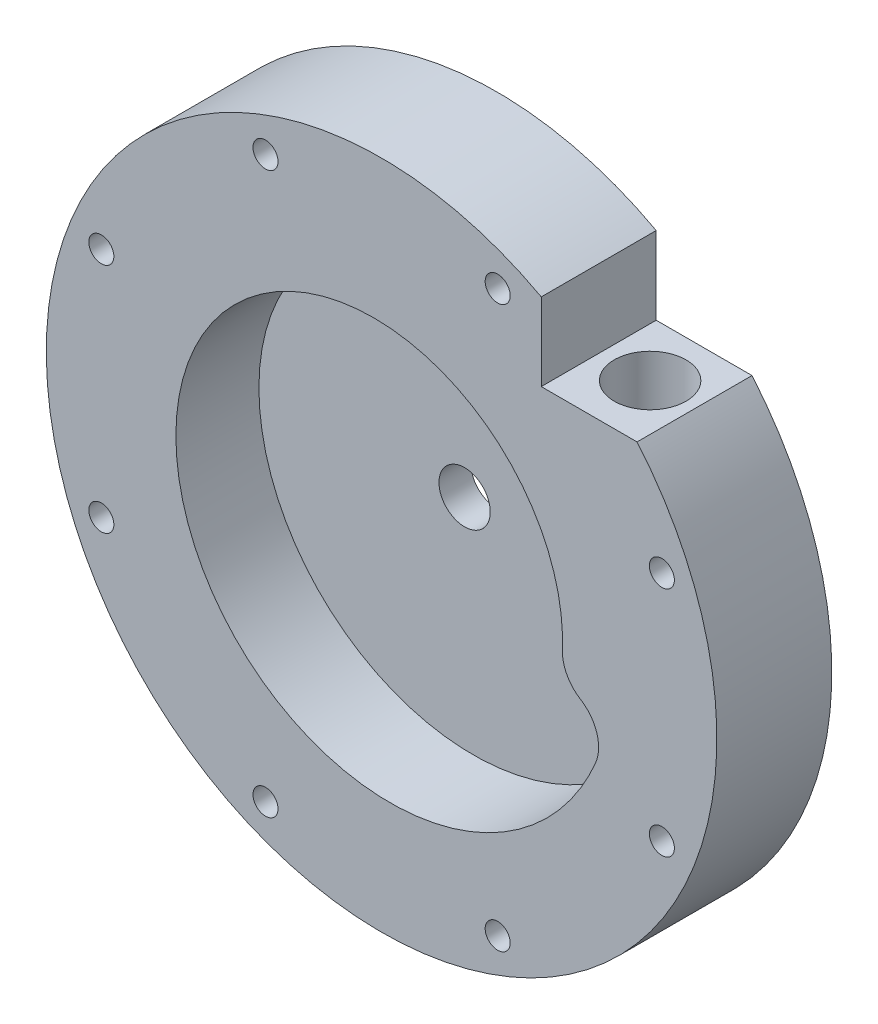
from build123d import *

# Parameters (mm, degrees)
VOLUTE_CUT_DEPTH      = 96.72717143
SKETCH28_W            = 19.053968595
SKETCH28_H            = 15.450138368
OUTLET_HOLE_CUT_DEPTH = 98.024176764
OUTLET_HOLE_D         = 9.8044
OUTLET_HOLE_DEPTH     = 55.88
OUTLET_HOLE_TIP       = 2.945538927
OUTLET_NPT_D          = 14.2748
OUTLET_NPT_DEPTH      = 12.7
OUTLET_NPT_TIP        = 4.288582582
FASTENER_HOLES_D      = 4.9784
CIRPATTERN1_COUNT     = 8


with BuildPart() as part:
    # Sketch22 → Main Body (revolve)
    with BuildSketch(Plane(origin=(0, 0, 0), x_dir=(1, 0, 0), z_dir=(0, 1, 0))):
        Polygon((-25.4, 0), (-5.1, 0), (-5.1, 6.35), (-11.1125, 6.35), (-11.1125, 4.7625), (-17.4625, 4.7625), (-17.4625, 6.35), (-66.675, 6.35), (-66.675, -16.51), (-25.4, -16.51), align=None)
    revolve(axis=Axis((0, 0, 0), (0, 0, -1)))

    # Sketch23 → Volute Cut (cut, through all)
    with BuildSketch(Plane.XY):
        with BuildLine():
            ThreePointArc((42.554027377, -16.231646763), (42.805320101, -10.94498561), (39.552581276, -6.769865934))
            ThreePointArc((39.552581276, -6.769865934), (36.836858206, -3.87137787), (35.948703812, 0))
            add(Edge.make_bspline(
                [(35.948703812, 0), (35.9515816, 0.07538119), (35.957337916, 0.226162951), (35.964207937, 0.452426553), (35.969771157, 0.678783022), (35.978029534, 1.131847853), (35.980843708, 2.190601907), (35.920311441, 3.779931016), (35.747323363, 5.668216834), (35.489928088, 7.474298946), (35.141459932, 9.268877369), (34.702390603, 11.047358984), (34.17343386, 12.80516853), (33.555538624, 14.537761538), (32.849887572, 16.240636382), (32.057893687, 17.909346365), (31.181197352, 19.53951152), (30.221662701, 21.126830276), (29.181373626, 22.667090912), (28.062629225, 24.156182809), (26.867938753, 25.590107465), (25.60001603, 26.964989265), (24.261773335, 28.277085961), (22.856314773, 29.522798851), (21.386929147, 30.698682629), (19.85708232, 31.801454876), (18.270409111, 32.828005175), (16.630704717, 33.775403815), (14.941915703, 34.640910073), (13.208130556, 35.421980041), (11.43356985, 36.116273987), (9.622576022, 36.721663214), (7.779602801, 37.236236415), (5.909204301, 37.658305492), (4.016023818, 37.986410831), (2.104782347, 38.219326014), (0.180266852, 38.356061949), (-1.75268168, 38.395870413), (-3.689180377, 38.338246992), (-5.624316777, 38.182933409), (-7.553161251, 37.929919231), (-9.470779522, 37.579442948), (-11.37224525, 37.131992419), (-13.252652651, 36.588304682), (-15.107129112, 35.949365124), (-16.930847778, 35.216406011), (-18.719040078, 34.390904381), (-20.467008144, 33.474579298), (-22.170137115, 32.469388481), (-23.823907266, 31.377524301), (-25.42390596, 30.201409162), (-26.965839357, 28.943690275), (-28.445543888, 27.607233836), (-29.858997424, 26.195118613), (-31.202330147, 24.710628968), (-32.471835063, 23.157247319), (-33.663978152, 21.538646066), (-34.775408104, 19.858679), (-35.802965645, 18.121372202), (-36.743692396, 16.330914471), (-37.594839261, 14.491647299), (-38.353874308, 12.608054401), (-39.018490139, 10.68475085), (-39.586610697, 8.726471825), (-40.056397525, 6.738061006), (-40.426255434, 4.724458642), (-40.694837576, 2.690689328), (-40.861049894, 0.641849508), (-40.924054953, -1.416905249), (-40.883275123, -3.480373184), (-40.738395114, -5.543319447), (-40.489363842, -7.600489337), (-40.13639564, -9.646621653), (-39.679970776, -11.676462103), (-39.120835312, -13.684776759), (-38.460000265, -15.666365517), (-37.698740094, -17.61607551), (-36.838590511, -19.528814477), (-35.881345602, -21.399564006), (-34.829054288, -23.223392663), (-33.684016107, -24.995468936), (-32.44877635, -26.711073982), (-31.126120537, -28.365614138), (-29.719068263, -29.954633155), (-28.230866416, -31.473824138), (-26.664981791, -32.919041144), (-25.025093105, -34.286310417), (-23.315082441, -35.571841228), (-21.53902614, -36.772036288), (-19.701185153, -37.883501708), (-17.805994889, -38.903056478), (-15.85805457, -39.827741435), (-13.862116128, -40.654827709), (-11.823072667, -41.381824596), (-9.745946518, -42.006486871), (-7.635876912, -42.526821485), (-5.498107312, -42.941093656), (-3.337972426, -43.247832311), (-1.160884928, -43.445834888), (1.027678058, -43.534171454), (3.222188708, -43.512188152), (5.417082419, -43.379509955), (7.606771886, -43.136042707), (9.785661288, -42.781974466), (11.948160555, -42.317776118), (14.08869967, -41.74420128), (16.201742982, -41.062285471), (18.281803484, -40.273344558), (20.323457017, -39.378972487), (22.321356376, -38.381038284), (24.27024527, -37.281682345), (26.164972102, -36.083312015), (28.000503535, -34.788596469), (29.77193781, -33.400460899), (31.474517775, -31.92208003), (33.103643596, -30.356870964), (34.654885111, -28.708485383), (36.123993806, -26.980801118), (37.506914359, -25.17791311), (38.799795742, -23.304123775), (39.999001844, -21.363932809), (41.101121576, -19.362026441), (41.938186302, -17.641904891), (42.402189205, -16.588613759), (42.554027377, -16.231646763)],
                knots=[0, 0, 0, 0, 0.000879209, 0.001758645, 0.002638305, 0.003518191, 0.007039982, 0.014977213, 0.022047939, 0.029133237, 0.036233164, 0.043347773, 0.050477114, 0.057621232, 0.06478017, 0.071953969, 0.079142669, 0.086346306, 0.093564916, 0.100798534, 0.108047194, 0.115310927, 0.122589766, 0.12988374, 0.13719288, 0.144517215, 0.151856774, 0.159211583, 0.16658167, 0.173967063, 0.181367786, 0.188783866, 0.196215328, 0.203662198, 0.211124498, 0.218602253, 0.226095488, 0.233604225, 0.241128486, 0.248668296, 0.256223676, 0.263794648, 0.271381234, 0.278983456, 0.286601335, 0.294234891, 0.301884146, 0.309549121, 0.317229835, 0.324926308, 0.332638561, 0.340366614, 0.348110485, 0.355870195, 0.363645762, 0.371437205, 0.379244543, 0.387067795, 0.39490698, 0.402762115, 0.410633219, 0.41852031, 0.426423405, 0.434342523, 0.442277682, 0.450228898, 0.458196189, 0.466179572, 0.474179065, 0.482194684, 0.490226447, 0.498274369, 0.506338468, 0.514418761, 0.522515263, 0.530627991, 0.538756962, 0.546902191, 0.555063694, 0.563241488, 0.571435588, 0.57964601, 0.58787277, 0.596115883, 0.604375364, 0.61265123, 0.620943495, 0.629252175, 0.637577285, 0.64591884, 0.654276855, 0.662651345, 0.671042324, 0.679449808, 0.687873812, 0.696314349, 0.704771435, 0.713245083, 0.721735309, 0.730242127, 0.738765551, 0.747305595, 0.755862273, 0.7644356, 0.77302559, 0.781632256, 0.790255613, 0.798895674, 0.807552454, 0.816225965, 0.824916222, 0.833623239, 0.842347028, 0.851087604, 0.859844979, 0.868619169, 0.877410184, 0.88621804, 0.895042749, 0.903884325, 0.912742781, 0.921618129, 0.930510383, 0.935031581, 0.935031581, 0.935031581, 0.935031581], degree=3))
        make_face()
    extrude(amount=VOLUTE_CUT_DEPTH, mode=Mode.SUBTRACT)

    # Sketch28 → Outlet Hole Cut (cut, through all)
    with BuildSketch(Plane.XY.offset(16.51)):
        with Locations((41.276984298, 50.905069184)):
            Rectangle(SKETCH28_W, SKETCH28_H)
    extrude(amount=-OUTLET_HOLE_CUT_DEPTH, mode=Mode.SUBTRACT)

    # Outlet Hole
    with Locations(Plane(origin=(41.529, 43.18, 4.637659), x_dir=(0, 0, 1), z_dir=(0, 1, 0))):
        with Locations((0, 0)):
            Hole(OUTLET_HOLE_D / 2, depth=OUTLET_HOLE_DEPTH)
            with Locations((0, 0, -(OUTLET_HOLE_DEPTH + OUTLET_HOLE_TIP / 2))):  # 118° drill point
                Cone(0, OUTLET_HOLE_D / 2, OUTLET_HOLE_TIP, mode=Mode.SUBTRACT)

    # Outlet NPT
    with Locations(Plane(origin=(41.529, 43.18, 4.637659), x_dir=(0, 0, 1), z_dir=(0, 1, 0))):
        with Locations((0, 0)):
            Hole(OUTLET_NPT_D / 2, depth=OUTLET_NPT_DEPTH)
            with Locations((0, 0, -(OUTLET_NPT_DEPTH + OUTLET_NPT_TIP / 2))):  # 118° drill point
                Cone(0, OUTLET_NPT_D / 2, OUTLET_NPT_TIP, mode=Mode.SUBTRACT)

    # Fastener Holes (through all)
    with Locations(Plane(origin=(55.733032799, -23.085378057, 16.51), x_dir=(1, 0, 0), z_dir=(0, 0, 1))):
        with Locations((0, 0)):
            fastener_holes = Hole(FASTENER_HOLES_D / 2)

    # CirPattern1: Fastener Holes ×8 about axis
    cirpattern1_axis = Axis((0, 0, 0), (0, 0, 1))
    for i in range(1, CIRPATTERN1_COUNT):
        add(fastener_holes.rotate(cirpattern1_axis, i * 360 / CIRPATTERN1_COUNT), mode=Mode.SUBTRACT)


solid = part.part
